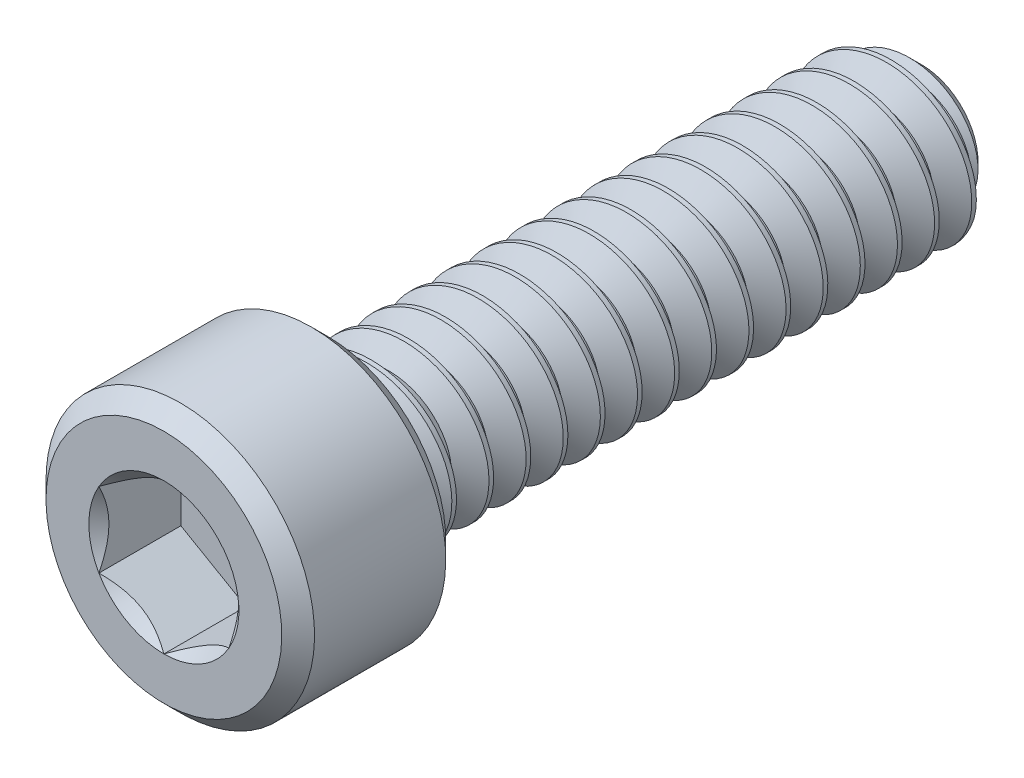
from build123d import *

# Parameters (mm, degrees)
CUT_EXTRUDE1_DEPTH = 1.7526
CUT_SWEEP1_PITCH   = 0.79375
CUT_SWEEP1_TO      = 12.7


with BuildPart() as part:
    # Sketch3 → Revolve1 (revolve)
    with BuildSketch(Plane(origin=(0, 0, 0), x_dir=(0, 0, -1), z_dir=(1, 0, 0))):
        Polygon((8.1026, 0), (-8.1026, 0), (-8.1026, 2.51968), (-7.75208, 2.8702), (-4.94792, 2.8702), (-4.5974, 2.51968), (-4.5974, 1.7526), (7.546975, 1.7526), (8.1026, 1.196975), align=None)
    revolve(axis=Axis((0, 0, -8.1026), (0, 0, 1)))

    # Sketch4 → Cut-Extrude1 (cut)
    with BuildSketch(Plane.XY.offset(8.1026)):
        Polygon((0, -1.603951217), (1.3890625, -0.801975608), (1.3890625, 0.801975608), (0, 1.603951217), (-1.3890625, 0.801975608), (-1.3890625, -0.801975608), align=None)
    extrude(amount=-CUT_EXTRUDE1_DEPTH, mode=Mode.SUBTRACT)

    # Cut-Extrude3 cone 1 section (through the dimple's axis) → Cut-Extrude3 (revolve, cut)
    with BuildSketch(Plane(origin=(0, 0, 8.1026), x_dir=(0, -1, 0), z_dir=(1, 0, 0))):
        Polygon((0, 0), (1.603951217, 0), (0, 1.603951217), align=None)
    revolve(axis=Axis((0, 0, 8.1026), (0, 0, -1)), mode=Mode.SUBTRACT)


with BuildPart() as body_2:
    # Split1: read off the stored shape, not the designer's step
    # Split1: the piece on the far side of the plane
    add(part.part)
    split(bisect_by=Plane.XY.offset(4.5974), keep=Keep.BOTTOM)

    # Cut-Sweep1: arcs per turn and ends read off the stored shape
    # Cut-Sweep1: the profile of Sketch7 screwed along a right-hand helix through 17 turns, 8 arcs to a turn; built about Z, then put on its axis
    cut_sweep1_z = Axis((0, 0, 0), (0, 0, 1))
    cut_sweep1_corners = [(1.795562979, 0, 0.024804687), (1.795562979, 0, -0.719335938), (1.237044252, 0, -0.396875), (1.237044252, 0, -0.29765625)]
    with BuildLine(mode=Mode.PRIVATE) as cut_sweep1_profile:
        Line(cut_sweep1_corners[0], cut_sweep1_corners[1])
        Line(cut_sweep1_corners[1], cut_sweep1_corners[2])
        Line(cut_sweep1_corners[2], cut_sweep1_corners[3])
        Line(cut_sweep1_corners[3], cut_sweep1_corners[0])
    cut_sweep1_cap = Face(cut_sweep1_profile.wire())
    cut_sweep1_turn_angles = [0, 22.5, 45, 67.5, 90, 112.5, 135, 157.5, 180, 202.5, 225, 247.5, 270, 292.5, 315, 337.5, 360]
    cut_sweep1_turn_weights = [1, 0.9238795325112867, 1, 0.9238795325112867, 1, 0.9238795325112867, 1, 0.9238795325112867, 1, 0.9238795325112867, 1, 0.9238795325112867, 1, 0.9238795325112867, 1, 0.9238795325112867, 1]
    cut_sweep1_turn_rails = [Edge.make_bspline([Vector(p[0], p[1], 0).rotate(cut_sweep1_z, cut_sweep1_turn_angles[k]) / cut_sweep1_turn_weights[k] + Vector(0, 0, p[2] + CUT_SWEEP1_PITCH * cut_sweep1_turn_angles[k] / 360) for k in range(17)], [0, 0, 0, 1, 1, 2, 2, 3, 3, 4, 4, 5, 5, 6, 6, 7, 7, 8, 8, 8], 2, cut_sweep1_turn_weights) for p in cut_sweep1_corners]
    cut_sweep1_turn_sides = [Face.make_surface_from_curves(cut_sweep1_turn_rails[p[0]], cut_sweep1_turn_rails[p[1]]) for p in [(0, 1), (1, 2), (2, 3), (3, 0)]]
    cut_sweep1 = Plane(origin=(0, 0, -8.1026), x_dir=(0, 1, 0), z_dir=(0, 0, 1)) * split(Solid(Shell([*[p.moved(Location((0, 0, CUT_SWEEP1_PITCH * i))) for i in range(17) for p in cut_sweep1_turn_sides], cut_sweep1_cap, cut_sweep1_cap.rotate(cut_sweep1_z, 6120).moved(Location((0, 0, CUT_SWEEP1_PITCH * 6120 / 360)))])), bisect_by=Plane.XY.offset(CUT_SWEEP1_TO), keep=Keep.BOTTOM, mode=Mode.PRIVATE)
    add(cut_sweep1, mode=Mode.SUBTRACT)


with BuildPart() as part_1:
    add(part.part)

    # Split1
    split(bisect_by=Plane.XY.offset(4.5974), keep=Keep.TOP)

    add(body_2.part)  # Boss-Extrude1 merges body 2
    # Boss-Extrude1: read off the stored shape, not the designer's step
    # Boss-Extrude1 outline → Boss-Extrude1 (revolve)
    with BuildSketch(Plane.XZ):
        Polygon((1.237043435, 4.5974), (1.237043435, 3.180919978), (1.7526, 4.5974), align=None)
    revolve(axis=Axis((0, 0, 0), (0, 0, 1)))


solid = part_1.part
